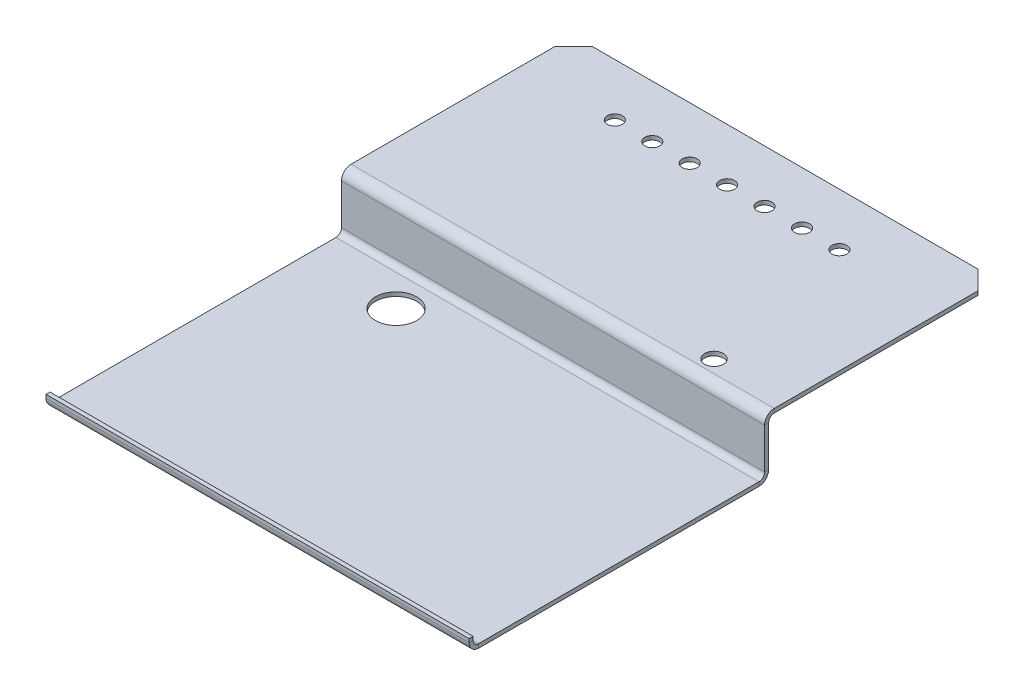
from build123d import *

# Parameters (mm, degrees)
SKETCH1_W                    = 2.15
SKETCH1_H                    = 124
BASE_FLANGE1_DEPTH           = 113
CHAMFER1_SIZE                = 10
EDGE_FLANGE1_STRIP_W         = 14.6
EDGE_FLANGE1_STRIP_H         = 2.15
EDGE_FLANGE1_STRIP_CUT_DEPTH = 226
EDGE_FLANGE1_DEPTH           = 226
EDGE_FLANGE2_STRIP_W         = 14.6
EDGE_FLANGE2_STRIP_H         = 2.15
EDGE_FLANGE2_STRIP_CUT_DEPTH = 226
EDGE_FLANGE2_DEPTH           = 226
EDGE_FLANGE3_STRIP_W         = 14.6
EDGE_FLANGE3_STRIP_H         = 2.15
EDGE_FLANGE3_STRIP_CUT_DEPTH = 226
EDGE_FLANGE3_DEPTH           = 226
SKETCH15_R                   = 11
CUT_EXTRUDE1_DEPTH           = 250.252928769
SKETCH16_R                   = 4
CUT_EXTRUDE2_DEPTH           = 250.252928769
LPATTERN1_COUNT              = 7
LPATTERN1_PITCH              = 20
SKETCH17_R                   = 5
CUT_EXTRUDE3_DEPTH           = 250.252928769


# Sheet-metal steps are written as plain solids
with BuildPart() as part:
    # Sketch1 → Base-Flange1 (new, symmetric)
    with BuildSketch(Plane(origin=(0, 0, 0), x_dir=(0, -1, 0), z_dir=(1, 0, 0))):
        with Locations((-1.075, 0)):
            Rectangle(SKETCH1_W, SKETCH1_H)
    extrude(amount=BASE_FLANGE1_DEPTH, both=True)

    # Chamfer1
    chamfer1_edges = [part.edges().sort_by_distance(p)[0] for p in [
        (113, 1.075, -62),
        (-113, 1.075, -62),
    ]]
    chamfer(chamfer1_edges, length=CHAMFER1_SIZE)

    # Edge-Flange1 strip (across the edge) → Edge-Flange1 strip cut (cut)
    with BuildSketch(Plane(origin=(113, 0, 62), x_dir=(0, 0, -1), z_dir=(-1, 0, 0))):
        with Locations((-2.15, -1.075)):
            Rectangle(EDGE_FLANGE1_STRIP_W, EDGE_FLANGE1_STRIP_H)
    extrude(amount=EDGE_FLANGE1_STRIP_CUT_DEPTH, mode=Mode.SUBTRACT)

    # Edge-Flange1 section (across the edge) → Edge-Flange1 (add)
    with BuildSketch(Plane(origin=(113, 0, 62), x_dir=(0, 0, -1), z_dir=(-1, 0, 0))):
        with BuildLine():
            Line((0, 3), (0, 29.85))
            Line((0, 29.85), (2.15, 29.85))
            Line((2.15, 29.85), (2.15, 3))
            ThreePointArc((2.15, 3), (3.028679656, 0.878679656), (5.15, 0))
            Line((5.15, 0), (5.15, -2.15))
            ThreePointArc((5.15, -2.15), (1.508400077, -0.641599923), (0, 3))
        make_face()
    extrude(amount=EDGE_FLANGE1_DEPTH)

    # Edge-Flange2 strip (across the edge) → Edge-Flange2 strip cut (cut)
    with BuildSketch(Plane(origin=(-113, -29.85, 62), x_dir=(0, 1, 0), z_dir=(1, 0, 0))):
        with Locations((-2.15, -1.075)):
            Rectangle(EDGE_FLANGE2_STRIP_W, EDGE_FLANGE2_STRIP_H)
    extrude(amount=EDGE_FLANGE2_STRIP_CUT_DEPTH, mode=Mode.SUBTRACT)

    # Edge-Flange2 section (across the edge) → Edge-Flange2 (add)
    with BuildSketch(Plane(origin=(-113, -29.85, 62), x_dir=(0, 1, 0), z_dir=(1, 0, 0))):
        with BuildLine():
            Line((0, 3), (0, 157.85))
            Line((0, 157.85), (2.15, 157.85))
            Line((2.15, 157.85), (2.15, 3))
            ThreePointArc((2.15, 3), (3.028679656, 0.878679656), (5.15, 0))
            Line((5.15, 0), (5.15, -2.15))
            ThreePointArc((5.15, -2.15), (1.508400077, -0.641599923), (0, 3))
        make_face()
    extrude(amount=EDGE_FLANGE2_DEPTH)

    # Edge-Flange3 strip (across the edge) → Edge-Flange3 strip cut (cut)
    with BuildSketch(Plane(origin=(-113, -27.7, 219.85), x_dir=(0, 0, -1), z_dir=(1, 0, 0))):
        with Locations((-2.15, -1.075)):
            Rectangle(EDGE_FLANGE3_STRIP_W, EDGE_FLANGE3_STRIP_H)
    extrude(amount=EDGE_FLANGE3_STRIP_CUT_DEPTH, mode=Mode.SUBTRACT)

    # Edge-Flange3 section (across the edge) → Edge-Flange3 (add)
    with BuildSketch(Plane(origin=(-113, -27.7, 219.85), x_dir=(0, 0, -1), z_dir=(1, 0, 0))):
        with BuildLine():
            Line((0, 3), (0, 4.85))
            Line((0, 4.85), (2.15, 4.85))
            Line((2.15, 4.85), (2.15, 3))
            ThreePointArc((2.15, 3), (3.028679656, 0.878679656), (5.15, 0))
            Line((5.15, 0), (5.15, -2.15))
            ThreePointArc((5.15, -2.15), (1.508400077, -0.641599923), (0, 3))
        make_face()
    extrude(amount=EDGE_FLANGE3_DEPTH)

    # Sketch15 → Cut-Extrude1 (cut, through all)
    with BuildSketch(Plane.XZ.offset(29.85)):
        with Locations(Location((-64, 81.85, 0), (0, 0, 270))):
            Circle(SKETCH15_R)
    extrude(amount=-CUT_EXTRUDE1_DEPTH, mode=Mode.SUBTRACT)

    # Sketch16 → Cut-Extrude2 (cut, through all)
    with BuildSketch(Plane(origin=(0, 2.15, 0), x_dir=(1, 0, 0), z_dir=(0, 1, 0))):
        with Locations(Location((-63, 34, 0), (0, 0, 270))):
            Circle(SKETCH16_R)
    cut_extrude2 = extrude(amount=-CUT_EXTRUDE2_DEPTH, mode=Mode.SUBTRACT)

    # LPattern1: Cut-Extrude2 ×7
    with Locations(*[(i * LPATTERN1_PITCH, 0, 0) for i in range(1, LPATTERN1_COUNT)]):
        add(cut_extrude2, mode=Mode.SUBTRACT)

    # Sketch17 → Cut-Extrude3 (cut, through all)
    with BuildSketch(Plane(origin=(0, 2.15, 0), x_dir=(1, 0, 0), z_dir=(0, 1, 0))):
        with Locations(Location((74, -50, 0), (0, 0, 270))):
            Circle(SKETCH17_R)
    extrude(amount=-CUT_EXTRUDE3_DEPTH, mode=Mode.SUBTRACT)


solid = part.part
